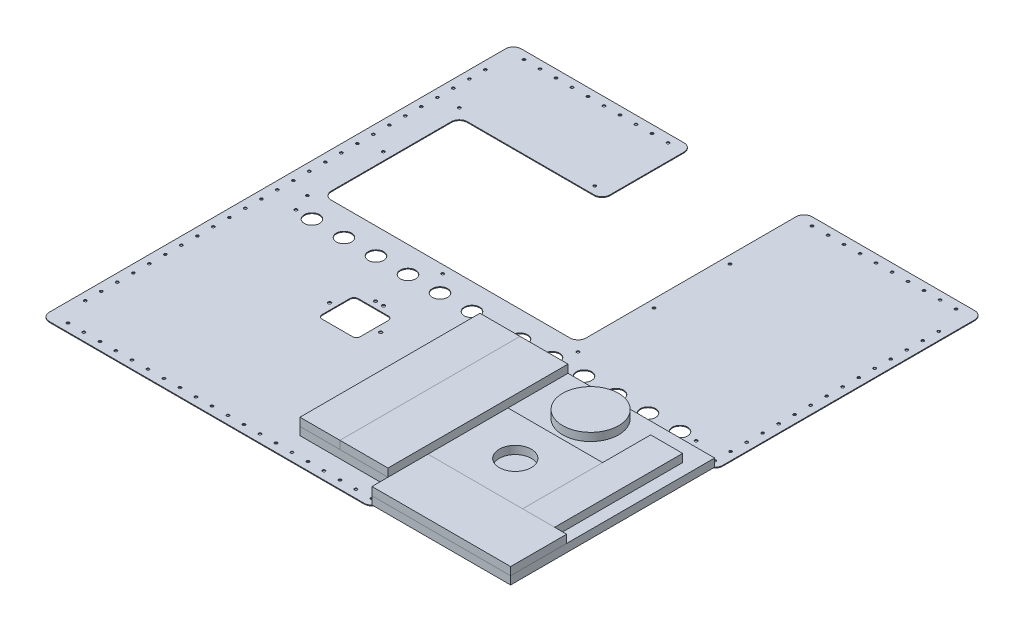
from build123d import *

# Parameters (mm, degrees)
SKETCH1_W                      = 586.53
SKETCH1_H                      = 590
BASE_FLANGE1_DEPTH             = 1
SKETCH6_W                      = 173.27
SKETCH6_H                      = 255
SKETCH6_W_2                    = 318.27
SKETCH6_H_2                    = 170
CUT_EXTRUDE1_DEPTH             = 10
SKETCH9_W                      = 140
SKETCH9_H                      = 112.51
CUT_EXTRUDE2_DEPTH             = 10
FILLET1_R                      = 10
M3_CLEARANCE_HOLE1_AT_2_COUNT  = 2
M3_CLEARANCE_HOLE1_AT_2_PITCH  = 169.135
M3_CLEARANCE_HOLE1_AT_3_COUNT  = 2
M3_CLEARANCE_HOLE1_AT_3_PITCH  = 338.27
M3_CLEARANCE_HOLE1_AT_4_COUNT  = 2
M3_CLEARANCE_HOLE1_AT_4_PITCH  = 351.356788607
M3_CLEARANCE_HOLE1_AT_5_COUNT  = 2
M3_CLEARANCE_HOLE1_AT_5_PITCH  = 387.977567522
M3_CLEARANCE_HOLE1_AT_6_COUNT  = 2
M3_CLEARANCE_HOLE1_AT_6_PITCH  = 254.375014939
M3_CLEARANCE_HOLE1_AT_7_COUNT  = 2
M3_CLEARANCE_HOLE1_AT_7_PITCH  = 190
M3_CLEARANCE_HOLE1_AT_8_COUNT  = 2
M3_CLEARANCE_HOLE1_AT_8_PITCH  = 95
M3_CLEARANCE_HOLE2_AT_2_COUNT  = 2
M3_CLEARANCE_HOLE2_AT_2_PITCH  = 20
M3_CLEARANCE_HOLE2_AT_3_COUNT  = 2
M3_CLEARANCE_HOLE2_AT_3_PITCH  = 40
M3_CLEARANCE_HOLE2_AT_4_COUNT  = 2
M3_CLEARANCE_HOLE2_AT_4_PITCH  = 60
M3_CLEARANCE_HOLE2_AT_5_COUNT  = 2
M3_CLEARANCE_HOLE2_AT_5_PITCH  = 80
M3_CLEARANCE_HOLE2_AT_6_COUNT  = 2
M3_CLEARANCE_HOLE2_AT_6_PITCH  = 100
M3_CLEARANCE_HOLE2_AT_7_COUNT  = 2
M3_CLEARANCE_HOLE2_AT_7_PITCH  = 120
M3_CLEARANCE_HOLE2_AT_8_COUNT  = 2
M3_CLEARANCE_HOLE2_AT_8_PITCH  = 140
M3_CLEARANCE_HOLE2_AT_9_COUNT  = 2
M3_CLEARANCE_HOLE2_AT_9_PITCH  = 160
M3_CLEARANCE_HOLE2_AT_10_COUNT = 2
M3_CLEARANCE_HOLE2_AT_10_PITCH = 180
M3_CLEARANCE_HOLE2_AT_11_COUNT = 2
M3_CLEARANCE_HOLE2_AT_11_PITCH = 200
M3_CLEARANCE_HOLE2_AT_12_COUNT = 2
M3_CLEARANCE_HOLE2_AT_12_PITCH = 220
M3_CLEARANCE_HOLE2_AT_13_COUNT = 2
M3_CLEARANCE_HOLE2_AT_13_PITCH = 240
M3_CLEARANCE_HOLE2_AT_14_COUNT = 2
M3_CLEARANCE_HOLE2_AT_14_PITCH = 260
M3_CLEARANCE_HOLE2_AT_15_COUNT = 2
M3_CLEARANCE_HOLE2_AT_15_PITCH = 280
M3_CLEARANCE_HOLE2_AT_16_COUNT = 2
M3_CLEARANCE_HOLE2_AT_16_PITCH = 300
M3_CLEARANCE_HOLE2_AT_17_COUNT = 2
M3_CLEARANCE_HOLE2_AT_17_PITCH = 320
M3_CLEARANCE_HOLE2_AT_18_COUNT = 2
M3_CLEARANCE_HOLE2_AT_18_PITCH = 340
M3_CLEARANCE_HOLE2_AT_19_COUNT = 2
M3_CLEARANCE_HOLE2_AT_19_PITCH = 360
M3_CLEARANCE_HOLE2_AT_20_COUNT = 2
M3_CLEARANCE_HOLE2_AT_20_PITCH = 380
M3_CLEARANCE_HOLE2_AT_21_COUNT = 2
M3_CLEARANCE_HOLE2_AT_21_PITCH = 37.427631504
M3_CLEARANCE_HOLE2_AT_22_COUNT = 2
M3_CLEARANCE_HOLE2_AT_22_PITCH = 56.575857042
M3_CLEARANCE_HOLE2_AT_23_COUNT = 2
M3_CLEARANCE_HOLE2_AT_23_PITCH = 76.163164325
M3_CLEARANCE_HOLE2_AT_24_COUNT = 2
M3_CLEARANCE_HOLE2_AT_24_PITCH = 95.920944532
M3_CLEARANCE_HOLE2_AT_25_COUNT = 2
M3_CLEARANCE_HOLE2_AT_25_PITCH = 115.76194366
M3_CLEARANCE_HOLE2_AT_26_COUNT = 2
M3_CLEARANCE_HOLE2_AT_26_PITCH = 135.649650202
M3_CLEARANCE_HOLE2_AT_27_COUNT = 2
M3_CLEARANCE_HOLE2_AT_27_PITCH = 155.566151845
M3_CLEARANCE_HOLE2_AT_28_COUNT = 2
M3_CLEARANCE_HOLE2_AT_28_PITCH = 175.501645576
M3_CLEARANCE_HOLE2_AT_29_COUNT = 2
M3_CLEARANCE_HOLE2_AT_29_PITCH = 195.45032003
M3_CLEARANCE_HOLE2_AT_30_COUNT = 2
M3_CLEARANCE_HOLE2_AT_30_PITCH = 215.408513295
M3_CLEARANCE_HOLE2_AT_31_COUNT = 2
M3_CLEARANCE_HOLE2_AT_31_PITCH = 235.37380398
M3_CLEARANCE_HOLE2_AT_32_COUNT = 2
M3_CLEARANCE_HOLE2_AT_32_PITCH = 255.344527257
M3_CLEARANCE_HOLE2_AT_33_COUNT = 2
M3_CLEARANCE_HOLE2_AT_33_PITCH = 275.319500944
M3_CLEARANCE_HOLE2_AT_34_COUNT = 2
M3_CLEARANCE_HOLE2_AT_34_PITCH = 295.297862505
M3_CLEARANCE_HOLE2_AT_35_COUNT = 2
M3_CLEARANCE_HOLE2_AT_35_PITCH = 315.2789679
M3_CLEARANCE_HOLE2_AT_36_COUNT = 2
M3_CLEARANCE_HOLE2_AT_36_PITCH = 335.262326544
M3_CLEARANCE_HOLE2_AT_37_COUNT = 2
M3_CLEARANCE_HOLE2_AT_37_PITCH = 355.24755819
M3_CLEARANCE_HOLE2_AT_38_COUNT = 2
M3_CLEARANCE_HOLE2_AT_38_PITCH = 375.234363565
M3_CLEARANCE_HOLE2_AT_39_COUNT = 2
M3_CLEARANCE_HOLE2_AT_39_PITCH = 395.222503914
M3_CLEARANCE_HOLE2_AT_40_COUNT = 2
M3_CLEARANCE_HOLE2_AT_40_PITCH = 415.211786442
M3_CLEARANCE_HOLE2_AT_41_COUNT = 2
M3_CLEARANCE_HOLE2_AT_41_PITCH = 435.202053764
M3_CLEARANCE_HOLE2_AT_42_COUNT = 2
M3_CLEARANCE_HOLE2_AT_42_PITCH = 455.193176135
M3_CLEARANCE_HOLE2_AT_43_COUNT = 2
M3_CLEARANCE_HOLE2_AT_43_PITCH = 475.18504564
M3_CLEARANCE_HOLE2_AT_44_COUNT = 2
M3_CLEARANCE_HOLE2_AT_44_PITCH = 495.177571786
M3_CLEARANCE_HOLE2_AT_45_COUNT = 2
M3_CLEARANCE_HOLE2_AT_45_PITCH = 515.170678125
M3_CLEARANCE_HOLE2_AT_46_COUNT = 2
M3_CLEARANCE_HOLE2_AT_46_PITCH = 535.164299631
M3_CLEARANCE_HOLE2_AT_47_COUNT = 2
M3_CLEARANCE_HOLE2_AT_47_PITCH = 769.631530604
M3_CLEARANCE_HOLE2_AT_48_COUNT = 2
M3_CLEARANCE_HOLE2_AT_48_PITCH = 755.865525672
M3_CLEARANCE_HOLE2_AT_49_COUNT = 2
M3_CLEARANCE_HOLE2_AT_49_PITCH = 742.383117332
M3_CLEARANCE_HOLE2_AT_50_COUNT = 2
M3_CLEARANCE_HOLE2_AT_50_PITCH = 729.200036273
M3_CLEARANCE_HOLE2_AT_51_COUNT = 2
M3_CLEARANCE_HOLE2_AT_51_PITCH = 716.332808756
M3_CLEARANCE_HOLE2_AT_52_COUNT = 2
M3_CLEARANCE_HOLE2_AT_52_PITCH = 703.798758808
M3_CLEARANCE_HOLE2_AT_53_COUNT = 2
M3_CLEARANCE_HOLE2_AT_53_PITCH = 691.616001044
M3_CLEARANCE_HOLE2_AT_54_COUNT = 2
M3_CLEARANCE_HOLE2_AT_54_PITCH = 679.803422248
M3_CLEARANCE_HOLE2_AT_55_COUNT = 2
M3_CLEARANCE_HOLE2_AT_55_PITCH = 668.380649705
M3_CLEARANCE_HOLE2_AT_56_COUNT = 2
M3_CLEARANCE_HOLE2_AT_56_PITCH = 657.368004165
M3_CLEARANCE_HOLE2_AT_57_COUNT = 2
M3_CLEARANCE_HOLE2_AT_57_PITCH = 646.786435309
M3_CLEARANCE_HOLE2_AT_58_COUNT = 2
M3_CLEARANCE_HOLE2_AT_58_PITCH = 636.657437638
M3_CLEARANCE_HOLE2_AT_59_COUNT = 2
M3_CLEARANCE_HOLE2_AT_59_PITCH = 627.002944889
M3_CLEARANCE_HOLE2_AT_60_COUNT = 2
M3_CLEARANCE_HOLE2_AT_60_PITCH = 617.845201406
M3_CLEARANCE_HOLE2_AT_61_COUNT = 2
M3_CLEARANCE_HOLE2_AT_61_PITCH = 609.20660937
M3_CLEARANCE_HOLE2_AT_62_COUNT = 2
M3_CLEARANCE_HOLE2_AT_62_PITCH = 570
M3_CLEARANCE_HOLE2_AT_63_COUNT = 2
M3_CLEARANCE_HOLE2_AT_63_PITCH = 570.350769264
M3_CLEARANCE_HOLE2_AT_64_COUNT = 2
M3_CLEARANCE_HOLE2_AT_64_PITCH = 571.401785086
M3_CLEARANCE_HOLE2_AT_65_COUNT = 2
M3_CLEARANCE_HOLE2_AT_65_PITCH = 573.149195236
M3_CLEARANCE_HOLE2_AT_66_COUNT = 2
M3_CLEARANCE_HOLE2_AT_66_PITCH = 575.586657246
M3_CLEARANCE_HOLE2_AT_67_COUNT = 2
M3_CLEARANCE_HOLE2_AT_67_PITCH = 578.705451849
M3_CLEARANCE_HOLE2_AT_68_COUNT = 2
M3_CLEARANCE_HOLE2_AT_68_PITCH = 582.494635168
M3_CLEARANCE_HOLE2_AT_69_COUNT = 2
M3_CLEARANCE_HOLE2_AT_69_PITCH = 586.941223633
M3_CLEARANCE_HOLE2_AT_70_COUNT = 2
M3_CLEARANCE_HOLE2_AT_70_PITCH = 592.030404625
M3_CLEARANCE_HOLE2_AT_71_COUNT = 2
M3_CLEARANCE_HOLE2_AT_71_PITCH = 597.745765355
M3_CLEARANCE_HOLE2_AT_72_COUNT = 2
M3_CLEARANCE_HOLE2_AT_72_PITCH = 785.182017178
M3_CLEARANCE_HOLE2_AT_73_COUNT = 2
M3_CLEARANCE_HOLE2_AT_73_PITCH = 771.563607294
M3_CLEARANCE_HOLE2_AT_74_COUNT = 2
M3_CLEARANCE_HOLE2_AT_74_PITCH = 758.228197906
M3_CLEARANCE_HOLE2_AT_75_COUNT = 2
M3_CLEARANCE_HOLE2_AT_75_PITCH = 745.190982299
M3_CLEARANCE_HOLE2_AT_76_COUNT = 2
M3_CLEARANCE_HOLE2_AT_76_PITCH = 732.467883323
M3_CLEARANCE_HOLE2_AT_77_COUNT = 2
M3_CLEARANCE_HOLE2_AT_77_PITCH = 720.075551661
M3_CLEARANCE_HOLE2_AT_78_COUNT = 2
M3_CLEARANCE_HOLE2_AT_78_PITCH = 708.031355309
M3_CLEARANCE_HOLE2_AT_79_COUNT = 2
M3_CLEARANCE_HOLE2_AT_79_PITCH = 696.353358648
M3_CLEARANCE_HOLE2_AT_80_COUNT = 2
M3_CLEARANCE_HOLE2_AT_80_PITCH = 685.060289391
M3_CLEARANCE_HOLE2_AT_81_COUNT = 2
M3_CLEARANCE_HOLE2_AT_81_PITCH = 674.17149161
SKETCH14_R                     = 9.55
CUT_EXTRUDE3_DEPTH             = 10
SKETCH15_R                     = 1.95
CUT_EXTRUDE5_DEPTH             = 416.969181821
SKETCH16_R                     = 1.75
CUT_EXTRUDE6_DEPTH             = 416.969181821
BOSS_EXTRUDE5_START            = 3
BOSS_EXTRUDE5_DEPTH            = 10
SKETCH18_W                     = 50
SKETCH18_H                     = 225
INSTRUMENTATION_DEPTH          = 10
SKETCH18_4_W                   = 59.995
SKETCH18_4_H                   = 225
LIFE_DETECTION_DEPTH           = 10
SKETCH18_5_R                   = 35
PROCESSING_CENTRIFUGE_DEPTH    = 10
PROCESSING_FILTRATION_DEPTH    = 10
COLLECTION_DEPTH               = 10
SKETCH18_9_W                   = 118.27
SKETCH18_9_H                   = 100
SKETCH18_9_R                   = 20
ELECTRICAL_SYSTEMS_DEPTH       = 10


# Sheet-metal steps are written as plain solids
with BuildPart() as part:
    # Sketch1 → Base-Flange1 (new body)
    with BuildSketch(Plane(origin=(0, 0, 0), x_dir=(1, 0, 0), z_dir=(0, 1, 0))):
        Rectangle(SKETCH1_W, SKETCH1_H)
    extrude(amount=-BASE_FLANGE1_DEPTH)

    # Sketch6 → Cut-Extrude1 (cut)
    with BuildSketch(Plane(origin=(0, 0, 0), x_dir=(1, 0, 0), z_dir=(0, 1, 0))):
        with Locations((206.63, -167.5)):
            Rectangle(SKETCH6_W, SKETCH6_H)
        with Locations((-89.13, 97.5)):
            Rectangle(SKETCH6_W_2, SKETCH6_H_2)
    extrude(amount=-CUT_EXTRUDE1_DEPTH, mode=Mode.SUBTRACT)

    # Sketch9 → Cut-Extrude2 (cut)
    with BuildSketch(Plane(origin=(0, 0, 0), x_dir=(1, 0, 0), z_dir=(0, 1, 0))):
        with Locations((0, 238.745)):
            Rectangle(SKETCH9_W, SKETCH9_H)
    extrude(amount=-CUT_EXTRUDE2_DEPTH, mode=Mode.SUBTRACT)

    # Fillet1
    fillet1_edges = [part.edges().sort_by_distance(p)[0] for p in [
        (293.265, -0.5, 40),
        (119.995, -0.5, 295),
        (119.995, -0.5, 40),
        (70.005, -0.5, -12.5),
        (-248.265, -0.5, -12.5),
        (-248.265, -0.5, -182.5),
        (-70, -0.5, -182.5),
        (-70, -0.5, -295),
        (70, -0.5, -295),
        (-293.265, -0.5, 295),
        (-293.265, -0.5, -295),
        (293.265, -0.5, -295),
    ]]
    fillet(fillet1_edges, radius=FILLET1_R)

    # Sketch11 → M3 Clearance Hole1 (revolve, cut)
    with BuildSketch(Plane(origin=(80.005, 0, -192.5), x_dir=(0, 0, 1), z_dir=(1, 0, 0))):
        Polygon((0, 0), (0, 1), (1.7, 1), (1.7, 0.025), (1.725, 0), align=None)
    m3_clearance_hole1 = revolve(axis=Axis((80.005, 6.35, -192.5), (0, -1, 0)), mode=Mode.SUBTRACT)

    # M3 Clearance Hole1 at 2: M3 Clearance Hole1 ×2
    with Locations(*[(-i * M3_CLEARANCE_HOLE1_AT_2_PITCH, 0, 0) for i in range(1, M3_CLEARANCE_HOLE1_AT_2_COUNT)]):
        add(m3_clearance_hole1, mode=Mode.SUBTRACT)

    # M3 Clearance Hole1 at 3: M3 Clearance Hole1 ×2
    with Locations(*[(-i * M3_CLEARANCE_HOLE1_AT_3_PITCH, 0, 0) for i in range(1, M3_CLEARANCE_HOLE1_AT_3_COUNT)]):
        add(m3_clearance_hole1, mode=Mode.SUBTRACT)

    # M3 Clearance Hole1 at 4: M3 Clearance Hole1 ×2
    with Locations(*[Vector(-0.9627535626717866, 0, 0.27038043117574634) * (i * M3_CLEARANCE_HOLE1_AT_4_PITCH) for i in range(1, M3_CLEARANCE_HOLE1_AT_4_COUNT)]):
        add(m3_clearance_hole1, mode=Mode.SUBTRACT)

    # M3 Clearance Hole1 at 5: M3 Clearance Hole1 ×2
    with Locations(*[Vector(-0.8718803052476541, 0, 0.48971903508160425) * (i * M3_CLEARANCE_HOLE1_AT_5_PITCH) for i in range(1, M3_CLEARANCE_HOLE1_AT_5_COUNT)]):
        add(m3_clearance_hole1, mode=Mode.SUBTRACT)

    # M3 Clearance Hole1 at 6: M3 Clearance Hole1 ×2
    with Locations(*[Vector(-0.6649041378566292, 0, 0.7469287030641766) * (i * M3_CLEARANCE_HOLE1_AT_6_PITCH) for i in range(1, M3_CLEARANCE_HOLE1_AT_6_COUNT)]):
        add(m3_clearance_hole1, mode=Mode.SUBTRACT)

    # M3 Clearance Hole1 at 7: M3 Clearance Hole1 ×2
    with Locations(*[(0, 0, i * M3_CLEARANCE_HOLE1_AT_7_PITCH) for i in range(1, M3_CLEARANCE_HOLE1_AT_7_COUNT)]):
        add(m3_clearance_hole1, mode=Mode.SUBTRACT)

    # M3 Clearance Hole1 at 8: M3 Clearance Hole1 ×2
    with Locations(*[(0, 0, i * M3_CLEARANCE_HOLE1_AT_8_PITCH) for i in range(1, M3_CLEARANCE_HOLE1_AT_8_COUNT)]):
        add(m3_clearance_hole1, mode=Mode.SUBTRACT)

    # Sketch13 → M3 Clearance Hole2 (revolve, cut)
    with BuildSketch(Plane(origin=(-270.005, 0, 285), x_dir=(0, 0, 1), z_dir=(1, 0, 0))):
        Polygon((0, 0), (0, 1), (1.7, 1), (1.7, 0.025), (1.725, 0), align=None)
    m3_clearance_hole2 = revolve(axis=Axis((-270.005, 6.35, 285), (0, -1, 0)), mode=Mode.SUBTRACT)

    # M3 Clearance Hole2 at 2: M3 Clearance Hole2 ×2
    with Locations(*[(i * M3_CLEARANCE_HOLE2_AT_2_PITCH, 0, 0) for i in range(1, M3_CLEARANCE_HOLE2_AT_2_COUNT)]):
        add(m3_clearance_hole2, mode=Mode.SUBTRACT)

    # M3 Clearance Hole2 at 3: M3 Clearance Hole2 ×2
    with Locations(*[(i * M3_CLEARANCE_HOLE2_AT_3_PITCH, 0, 0) for i in range(1, M3_CLEARANCE_HOLE2_AT_3_COUNT)]):
        add(m3_clearance_hole2, mode=Mode.SUBTRACT)

    # M3 Clearance Hole2 at 4: M3 Clearance Hole2 ×2
    with Locations(*[(i * M3_CLEARANCE_HOLE2_AT_4_PITCH, 0, 0) for i in range(1, M3_CLEARANCE_HOLE2_AT_4_COUNT)]):
        add(m3_clearance_hole2, mode=Mode.SUBTRACT)

    # M3 Clearance Hole2 at 5: M3 Clearance Hole2 ×2
    with Locations(*[(i * M3_CLEARANCE_HOLE2_AT_5_PITCH, 0, 0) for i in range(1, M3_CLEARANCE_HOLE2_AT_5_COUNT)]):
        add(m3_clearance_hole2, mode=Mode.SUBTRACT)

    # M3 Clearance Hole2 at 6: M3 Clearance Hole2 ×2
    with Locations(*[(i * M3_CLEARANCE_HOLE2_AT_6_PITCH, 0, 0) for i in range(1, M3_CLEARANCE_HOLE2_AT_6_COUNT)]):
        add(m3_clearance_hole2, mode=Mode.SUBTRACT)

    # M3 Clearance Hole2 at 7: M3 Clearance Hole2 ×2
    with Locations(*[(i * M3_CLEARANCE_HOLE2_AT_7_PITCH, 0, 0) for i in range(1, M3_CLEARANCE_HOLE2_AT_7_COUNT)]):
        add(m3_clearance_hole2, mode=Mode.SUBTRACT)

    # M3 Clearance Hole2 at 8: M3 Clearance Hole2 ×2
    with Locations(*[(i * M3_CLEARANCE_HOLE2_AT_8_PITCH, 0, 0) for i in range(1, M3_CLEARANCE_HOLE2_AT_8_COUNT)]):
        add(m3_clearance_hole2, mode=Mode.SUBTRACT)

    # M3 Clearance Hole2 at 9: M3 Clearance Hole2 ×2
    with Locations(*[(i * M3_CLEARANCE_HOLE2_AT_9_PITCH, 0, 0) for i in range(1, M3_CLEARANCE_HOLE2_AT_9_COUNT)]):
        add(m3_clearance_hole2, mode=Mode.SUBTRACT)

    # M3 Clearance Hole2 at 10: M3 Clearance Hole2 ×2
    with Locations(*[(i * M3_CLEARANCE_HOLE2_AT_10_PITCH, 0, 0) for i in range(1, M3_CLEARANCE_HOLE2_AT_10_COUNT)]):
        add(m3_clearance_hole2, mode=Mode.SUBTRACT)

    # M3 Clearance Hole2 at 11: M3 Clearance Hole2 ×2
    with Locations(*[(i * M3_CLEARANCE_HOLE2_AT_11_PITCH, 0, 0) for i in range(1, M3_CLEARANCE_HOLE2_AT_11_COUNT)]):
        add(m3_clearance_hole2, mode=Mode.SUBTRACT)

    # M3 Clearance Hole2 at 12: M3 Clearance Hole2 ×2
    with Locations(*[(i * M3_CLEARANCE_HOLE2_AT_12_PITCH, 0, 0) for i in range(1, M3_CLEARANCE_HOLE2_AT_12_COUNT)]):
        add(m3_clearance_hole2, mode=Mode.SUBTRACT)

    # M3 Clearance Hole2 at 13: M3 Clearance Hole2 ×2
    with Locations(*[(i * M3_CLEARANCE_HOLE2_AT_13_PITCH, 0, 0) for i in range(1, M3_CLEARANCE_HOLE2_AT_13_COUNT)]):
        add(m3_clearance_hole2, mode=Mode.SUBTRACT)

    # M3 Clearance Hole2 at 14: M3 Clearance Hole2 ×2
    with Locations(*[(i * M3_CLEARANCE_HOLE2_AT_14_PITCH, 0, 0) for i in range(1, M3_CLEARANCE_HOLE2_AT_14_COUNT)]):
        add(m3_clearance_hole2, mode=Mode.SUBTRACT)

    # M3 Clearance Hole2 at 15: M3 Clearance Hole2 ×2
    with Locations(*[(i * M3_CLEARANCE_HOLE2_AT_15_PITCH, 0, 0) for i in range(1, M3_CLEARANCE_HOLE2_AT_15_COUNT)]):
        add(m3_clearance_hole2, mode=Mode.SUBTRACT)

    # M3 Clearance Hole2 at 16: M3 Clearance Hole2 ×2
    with Locations(*[(i * M3_CLEARANCE_HOLE2_AT_16_PITCH, 0, 0) for i in range(1, M3_CLEARANCE_HOLE2_AT_16_COUNT)]):
        add(m3_clearance_hole2, mode=Mode.SUBTRACT)

    # M3 Clearance Hole2 at 17: M3 Clearance Hole2 ×2
    with Locations(*[(i * M3_CLEARANCE_HOLE2_AT_17_PITCH, 0, 0) for i in range(1, M3_CLEARANCE_HOLE2_AT_17_COUNT)]):
        add(m3_clearance_hole2, mode=Mode.SUBTRACT)

    # M3 Clearance Hole2 at 18: M3 Clearance Hole2 ×2
    with Locations(*[(i * M3_CLEARANCE_HOLE2_AT_18_PITCH, 0, 0) for i in range(1, M3_CLEARANCE_HOLE2_AT_18_COUNT)]):
        add(m3_clearance_hole2, mode=Mode.SUBTRACT)

    # M3 Clearance Hole2 at 19: M3 Clearance Hole2 ×2
    with Locations(*[(i * M3_CLEARANCE_HOLE2_AT_19_PITCH, 0, 0) for i in range(1, M3_CLEARANCE_HOLE2_AT_19_COUNT)]):
        add(m3_clearance_hole2, mode=Mode.SUBTRACT)

    # M3 Clearance Hole2 at 20: M3 Clearance Hole2 ×2
    with Locations(*[(i * M3_CLEARANCE_HOLE2_AT_20_PITCH, 0, 0) for i in range(1, M3_CLEARANCE_HOLE2_AT_20_COUNT)]):
        add(m3_clearance_hole2, mode=Mode.SUBTRACT)

    # M3 Clearance Hole2 at 21: M3 Clearance Hole2 ×2
    with Locations(*[Vector(-0.3542837061057186, 0, -0.9351379874585337) * (i * M3_CLEARANCE_HOLE2_AT_21_PITCH) for i in range(1, M3_CLEARANCE_HOLE2_AT_21_COUNT)]):
        add(m3_clearance_hole2, mode=Mode.SUBTRACT)

    # M3 Clearance Hole2 at 22: M3 Clearance Hole2 ×2
    with Locations(*[Vector(-0.23437559222889967, 0, -0.9721461216130797) * (i * M3_CLEARANCE_HOLE2_AT_22_PITCH) for i in range(1, M3_CLEARANCE_HOLE2_AT_22_COUNT)]):
        add(m3_clearance_hole2, mode=Mode.SUBTRACT)

    # M3 Clearance Hole2 at 23: M3 Clearance Hole2 ×2
    with Locations(*[Vector(-0.1740999092870426, 0, -0.9847279937049843) * (i * M3_CLEARANCE_HOLE2_AT_23_PITCH) for i in range(1, M3_CLEARANCE_HOLE2_AT_23_COUNT)]):
        add(m3_clearance_hole2, mode=Mode.SUBTRACT)

    # M3 Clearance Hole2 at 24: M3 Clearance Hole2 ×2
    with Locations(*[Vector(-0.138238838917109, 0, -0.9903989213518205) * (i * M3_CLEARANCE_HOLE2_AT_24_PITCH) for i in range(1, M3_CLEARANCE_HOLE2_AT_24_COUNT)]):
        add(m3_clearance_hole2, mode=Mode.SUBTRACT)

    # M3 Clearance Hole2 at 25: M3 Clearance Hole2 ×2
    with Locations(*[Vector(-0.11454541605587176, 0, -0.9934180125509037) * (i * M3_CLEARANCE_HOLE2_AT_25_PITCH) for i in range(1, M3_CLEARANCE_HOLE2_AT_25_COUNT)]):
        add(m3_clearance_hole2, mode=Mode.SUBTRACT)

    # M3 Clearance Hole2 at 26: M3 Clearance Hole2 ×2
    with Locations(*[Vector(-0.09775181860201942, 0, -0.9952108228712135) * (i * M3_CLEARANCE_HOLE2_AT_26_PITCH) for i in range(1, M3_CLEARANCE_HOLE2_AT_26_COUNT)]):
        add(m3_clearance_hole2, mode=Mode.SUBTRACT)

    # M3 Clearance Hole2 at 27: M3 Clearance Hole2 ×2
    with Locations(*[Vector(-0.08523705087964259, 0, -0.9963607003276179) * (i * M3_CLEARANCE_HOLE2_AT_27_PITCH) for i in range(1, M3_CLEARANCE_HOLE2_AT_27_COUNT)]):
        add(m3_clearance_hole2, mode=Mode.SUBTRACT)

    # M3 Clearance Hole2 at 28: M3 Clearance Hole2 ×2
    with Locations(*[Vector(-0.07555484711528443, 0, -0.9971416474490402) * (i * M3_CLEARANCE_HOLE2_AT_28_PITCH) for i in range(1, M3_CLEARANCE_HOLE2_AT_28_COUNT)]):
        add(m3_clearance_hole2, mode=Mode.SUBTRACT)

    # M3 Clearance Hole2 at 29: M3 Clearance Hole2 ×2
    with Locations(*[Vector(-0.06784332713262199, 0, -0.997695987244399) * (i * M3_CLEARANCE_HOLE2_AT_29_PITCH) for i in range(1, M3_CLEARANCE_HOLE2_AT_29_COUNT)]):
        add(m3_clearance_hole2, mode=Mode.SUBTRACT)

    # M3 Clearance Hole2 at 30: M3 Clearance Hole2 ×2
    with Locations(*[Vector(-0.06155745563238609, 0, -0.9981035415507085) * (i * M3_CLEARANCE_HOLE2_AT_30_PITCH) for i in range(1, M3_CLEARANCE_HOLE2_AT_30_COUNT)]):
        add(m3_clearance_hole2, mode=Mode.SUBTRACT)

    # M3 Clearance Hole2 at 31: M3 Clearance Hole2 ×2
    with Locations(*[Vector(-0.056335920887480066, 0, -0.9984118709319113) * (i * M3_CLEARANCE_HOLE2_AT_31_PITCH) for i in range(1, M3_CLEARANCE_HOLE2_AT_31_COUNT)]):
        add(m3_clearance_hole2, mode=Mode.SUBTRACT)

    # M3 Clearance Hole2 at 32: M3 Clearance Hole2 ×2
    with Locations(*[Vector(-0.051929838256000956, 0, -0.9986507356922668) * (i * M3_CLEARANCE_HOLE2_AT_32_PITCH) for i in range(1, M3_CLEARANCE_HOLE2_AT_32_COUNT)]):
        add(m3_clearance_hole2, mode=Mode.SUBTRACT)

    # M3 Clearance Hole2 at 33: M3 Clearance Hole2 ×2
    with Locations(*[Vector(-0.04816222590314291, 0, -0.9988395266488279) * (i * M3_CLEARANCE_HOLE2_AT_33_PITCH) for i in range(1, M3_CLEARANCE_HOLE2_AT_33_COUNT)]):
        add(m3_clearance_hole2, mode=Mode.SUBTRACT)

    # M3 Clearance Hole2 at 34: M3 Clearance Hole2 ×2
    with Locations(*[Vector(-0.04490381300940858, 0, -0.9989913150659601) * (i * M3_CLEARANCE_HOLE2_AT_34_PITCH) for i in range(1, M3_CLEARANCE_HOLE2_AT_34_COUNT)]):
        add(m3_clearance_hole2, mode=Mode.SUBTRACT)

    # M3 Clearance Hole2 at 35: M3 Clearance Hole2 ×2
    with Locations(*[Vector(-0.04205799101769677, 0, -0.9991151712348059) * (i * M3_CLEARANCE_HOLE2_AT_35_PITCH) for i in range(1, M3_CLEARANCE_HOLE2_AT_35_COUNT)]):
        add(m3_clearance_hole2, mode=Mode.SUBTRACT)

    # M3 Clearance Hole2 at 36: M3 Clearance Hole2 ×2
    with Locations(*[Vector(-0.039551118482866195, 0, -0.9992175483981225) * (i * M3_CLEARANCE_HOLE2_AT_36_PITCH) for i in range(1, M3_CLEARANCE_HOLE2_AT_36_COUNT)]):
        add(m3_clearance_hole2, mode=Mode.SUBTRACT)

    # M3 Clearance Hole2 at 37: M3 Clearance Hole2 ×2
    with Locations(*[Vector(-0.03732608344321662, 0, -0.9993031389397264) * (i * M3_CLEARANCE_HOLE2_AT_37_PITCH) for i in range(1, M3_CLEARANCE_HOLE2_AT_37_COUNT)]):
        add(m3_clearance_hole2, mode=Mode.SUBTRACT)

    # M3 Clearance Hole2 at 38: M3 Clearance Hole2 ×2
    with Locations(*[Vector(-0.03533791488077733, 0, -0.9993754208363737) * (i * M3_CLEARANCE_HOLE2_AT_38_PITCH) for i in range(1, M3_CLEARANCE_HOLE2_AT_38_COUNT)]):
        add(m3_clearance_hole2, mode=Mode.SUBTRACT)

    # M3 Clearance Hole2 at 39: M3 Clearance Hole2 ×2
    with Locations(*[Vector(-0.03355072109681487, 0, -0.9994370160814956) * (i * M3_CLEARANCE_HOLE2_AT_39_PITCH) for i in range(1, M3_CLEARANCE_HOLE2_AT_39_COUNT)]):
        add(m3_clearance_hole2, mode=Mode.SUBTRACT)

    # M3 Clearance Hole2 at 40: M3 Clearance Hole2 ×2
    with Locations(*[Vector(-0.03193550961941994, 0, -0.9994899315277508) * (i * M3_CLEARANCE_HOLE2_AT_40_PITCH) for i in range(1, M3_CLEARANCE_HOLE2_AT_40_COUNT)]):
        add(m3_clearance_hole2, mode=Mode.SUBTRACT)

    # M3 Clearance Hole2 at 41: M3 Clearance Hole2 ×2
    with Locations(*[Vector(-0.03046860621481826, 0, -0.9995357242416733) * (i * M3_CLEARANCE_HOLE2_AT_41_PITCH) for i in range(1, M3_CLEARANCE_HOLE2_AT_41_COUNT)]):
        add(m3_clearance_hole2, mode=Mode.SUBTRACT)

    # M3 Clearance Hole2 at 42: M3 Clearance Hole2 ×2
    with Locations(*[Vector(-0.02913048941679347, 0, -0.9995756172428067) * (i * M3_CLEARANCE_HOLE2_AT_42_PITCH) for i in range(1, M3_CLEARANCE_HOLE2_AT_42_COUNT)]):
        add(m3_clearance_hole2, mode=Mode.SUBTRACT)

    # M3 Clearance Hole2 at 43: M3 Clearance Hole2 ×2
    with Locations(*[Vector(-0.027904918561018805, 0, -0.9996105819368375) * (i * M3_CLEARANCE_HOLE2_AT_43_PITCH) for i in range(1, M3_CLEARANCE_HOLE2_AT_43_COUNT)]):
        add(m3_clearance_hole2, mode=Mode.SUBTRACT)

    # M3 Clearance Hole2 at 44: M3 Clearance Hole2 ×2
    with Locations(*[Vector(-0.026778272594560903, 0, -0.9996413977606426) * (i * M3_CLEARANCE_HOLE2_AT_44_PITCH) for i in range(1, M3_CLEARANCE_HOLE2_AT_44_COUNT)]):
        add(m3_clearance_hole2, mode=Mode.SUBTRACT)

    # M3 Clearance Hole2 at 45: M3 Clearance Hole2 ×2
    with Locations(*[Vector(-0.02573904254072972, 0, -0.9996686959633609) * (i * M3_CLEARANCE_HOLE2_AT_45_PITCH) for i in range(1, M3_CLEARANCE_HOLE2_AT_45_COUNT)]):
        add(m3_clearance_hole2, mode=Mode.SUBTRACT)

    # M3 Clearance Hole2 at 46: M3 Clearance Hole2 ×2
    with Locations(*[Vector(-0.024777437525511124, 0, -0.9996929921679303) * (i * M3_CLEARANCE_HOLE2_AT_46_PITCH) for i in range(1, M3_CLEARANCE_HOLE2_AT_46_COUNT)]):
        add(m3_clearance_hole2, mode=Mode.SUBTRACT)

    # M3 Clearance Hole2 at 47: M3 Clearance Hole2 ×2
    with Locations(*[Vector(0.7188764727008147, 0, -0.6951378402858205) * (i * M3_CLEARANCE_HOLE2_AT_47_PITCH) for i in range(1, M3_CLEARANCE_HOLE2_AT_47_COUNT)]):
        add(m3_clearance_hole2, mode=Mode.SUBTRACT)

    # M3 Clearance Hole2 at 48: M3 Clearance Hole2 ×2
    with Locations(*[Vector(0.7319688240945119, 0, -0.6813381249817874) * (i * M3_CLEARANCE_HOLE2_AT_48_PITCH) for i in range(1, M3_CLEARANCE_HOLE2_AT_48_COUNT)]):
        add(m3_clearance_hole2, mode=Mode.SUBTRACT)

    # M3 Clearance Hole2 at 49: M3 Clearance Hole2 ×2
    with Locations(*[Vector(0.7452620986158033, 0, -0.6667716283456944) * (i * M3_CLEARANCE_HOLE2_AT_49_PITCH) for i in range(1, M3_CLEARANCE_HOLE2_AT_49_COUNT)]):
        add(m3_clearance_hole2, mode=Mode.SUBTRACT)

    # M3 Clearance Hole2 at 50: M3 Clearance Hole2 ×2
    with Locations(*[Vector(0.7587355629164406, 0, -0.6513987607954685) * (i * M3_CLEARANCE_HOLE2_AT_50_PITCH) for i in range(1, M3_CLEARANCE_HOLE2_AT_50_COUNT)]):
        add(m3_clearance_hole2, mode=Mode.SUBTRACT)

    # M3 Clearance Hole2 at 51: M3 Clearance Hole2 ×2
    with Locations(*[Vector(0.7723644557911035, 0, -0.6351796182423618) * (i * M3_CLEARANCE_HOLE2_AT_51_PITCH) for i in range(1, M3_CLEARANCE_HOLE2_AT_51_COUNT)]):
        add(m3_clearance_hole2, mode=Mode.SUBTRACT)

    # M3 Clearance Hole2 at 52: M3 Clearance Hole2 ×2
    with Locations(*[Vector(0.7861196017692288, 0, -0.6180744062927934) * (i * M3_CLEARANCE_HOLE2_AT_52_PITCH) for i in range(1, M3_CLEARANCE_HOLE2_AT_52_COUNT)]):
        add(m3_clearance_hole2, mode=Mode.SUBTRACT)

    # M3 Clearance Hole2 at 53: M3 Clearance Hole2 ×2
    with Locations(*[Vector(0.7999670325222225, 0, -0.600043954121354) * (i * M3_CLEARANCE_HOLE2_AT_53_PITCH) for i in range(1, M3_CLEARANCE_HOLE2_AT_53_COUNT)]):
        add(m3_clearance_hole2, mode=Mode.SUBTRACT)

    # M3 Clearance Hole2 at 54: M3 Clearance Hole2 ×2
    with Locations(*[Vector(0.8138676298075721, 0, -0.5810503258336619) * (i * M3_CLEARANCE_HOLE2_AT_54_PITCH) for i in range(1, M3_CLEARANCE_HOLE2_AT_54_COUNT)]):
        add(m3_clearance_hole2, mode=Mode.SUBTRACT)

    # M3 Clearance Hole2 at 55: M3 Clearance Hole2 ×2
    with Locations(*[Vector(0.8277768068902698, 0, -0.5610575353513659) * (i * M3_CLEARANCE_HOLE2_AT_55_PITCH) for i in range(1, M3_CLEARANCE_HOLE2_AT_55_COUNT)]):
        add(m3_clearance_hole2, mode=Mode.SUBTRACT)

    # M3 Clearance Hole2 at 56: M3 Clearance Hole2 ×2
    with Locations(*[Vector(0.8416442487228958, 0, -0.5400323680962766) * (i * M3_CLEARANCE_HOLE2_AT_56_PITCH) for i in range(1, M3_CLEARANCE_HOLE2_AT_56_COUNT)]):
        add(m3_clearance_hole2, mode=Mode.SUBTRACT)

    # M3 Clearance Hole2 at 57: M3 Clearance Hole2 ×2
    with Locations(*[Vector(0.8554137344199167, 0, -0.5179453088558408) * (i * M3_CLEARANCE_HOLE2_AT_57_PITCH) for i in range(1, M3_CLEARANCE_HOLE2_AT_57_COUNT)]):
        add(m3_clearance_hole2, mode=Mode.SUBTRACT)

    # M3 Clearance Hole2 at 58: M3 Clearance Hole2 ×2
    with Locations(*[Vector(0.8690230684376916, 0, -0.4947715700433274) * (i * M3_CLEARANCE_HOLE2_AT_58_PITCH) for i in range(1, M3_CLEARANCE_HOLE2_AT_58_COUNT)]):
        add(m3_clearance_hole2, mode=Mode.SUBTRACT)

    # M3 Clearance Hole2 at 59: M3 Clearance Hole2 ×2
    with Locations(*[Vector(0.8824041489910074, 0, -0.4704922080581741) * (i * M3_CLEARANCE_HOLE2_AT_59_PITCH) for i in range(1, M3_CLEARANCE_HOLE2_AT_59_COUNT)]):
        add(m3_clearance_hole2, mode=Mode.SUBTRACT)

    # M3 Clearance Hole2 at 60: M3 Clearance Hole2 ×2
    with Locations(*[Vector(0.8954832031409422, 0, -0.44509530765043814) * (i * M3_CLEARANCE_HOLE2_AT_60_PITCH) for i in range(1, M3_CLEARANCE_HOLE2_AT_60_COUNT)]):
        add(m3_clearance_hole2, mode=Mode.SUBTRACT)

    # M3 Clearance Hole2 at 61: M3 Clearance Hole2 ×2
    with Locations(*[Vector(0.9081812171608301, 0, -0.41857720529942055) * (i * M3_CLEARANCE_HOLE2_AT_61_PITCH) for i in range(1, M3_CLEARANCE_HOLE2_AT_61_COUNT)]):
        add(m3_clearance_hole2, mode=Mode.SUBTRACT)

    # M3 Clearance Hole2 at 62: M3 Clearance Hole2 ×2
    with Locations(*[(0, 0, -i * M3_CLEARANCE_HOLE2_AT_62_PITCH) for i in range(1, M3_CLEARANCE_HOLE2_AT_62_COUNT)]):
        add(m3_clearance_hole2, mode=Mode.SUBTRACT)

    # M3 Clearance Hole2 at 63: M3 Clearance Hole2 ×2
    with Locations(*[Vector(0.0350661401330445, 0, -0.9993849937917668) * (i * M3_CLEARANCE_HOLE2_AT_63_PITCH) for i in range(1, M3_CLEARANCE_HOLE2_AT_63_COUNT)]):
        add(m3_clearance_hole2, mode=Mode.SUBTRACT)

    # M3 Clearance Hole2 at 64: M3 Clearance Hole2 ×2
    with Locations(*[Vector(0.07000328148073091, 0, -0.9975467611004155) * (i * M3_CLEARANCE_HOLE2_AT_64_PITCH) for i in range(1, M3_CLEARANCE_HOLE2_AT_64_COUNT)]):
        add(m3_clearance_hole2, mode=Mode.SUBTRACT)

    # M3 Clearance Hole2 at 65: M3 Clearance Hole2 ×2
    with Locations(*[Vector(0.10468478451804275, 0, -0.9945054529214061) * (i * M3_CLEARANCE_HOLE2_AT_65_PITCH) for i in range(1, M3_CLEARANCE_HOLE2_AT_65_COUNT)]):
        add(m3_clearance_hole2, mode=Mode.SUBTRACT)

    # M3 Clearance Hole2 at 66: M3 Clearance Hole2 ×2
    with Locations(*[Vector(0.13898862837218873, 0, -0.9902939771518444) * (i * M3_CLEARANCE_HOLE2_AT_66_PITCH) for i in range(1, M3_CLEARANCE_HOLE2_AT_66_COUNT)]):
        add(m3_clearance_hole2, mode=Mode.SUBTRACT)

    # M3 Clearance Hole2 at 67: M3 Clearance Hole2 ×2
    with Locations(*[Vector(0.17279947800812526, 0, -0.984957024646314) * (i * M3_CLEARANCE_HOLE2_AT_67_PITCH) for i in range(1, M3_CLEARANCE_HOLE2_AT_67_COUNT)]):
        add(m3_clearance_hole2, mode=Mode.SUBTRACT)

    # M3 Clearance Hole2 at 68: M3 Clearance Hole2 ×2
    with Locations(*[Vector(0.2060104810498419, 0, -0.978549784986749) * (i * M3_CLEARANCE_HOLE2_AT_68_PITCH) for i in range(1, M3_CLEARANCE_HOLE2_AT_68_COUNT)]):
        add(m3_clearance_hole2, mode=Mode.SUBTRACT)

    # M3 Clearance Hole2 at 69: M3 Clearance Hole2 ×2
    with Locations(*[Vector(0.23852473529359494, 0, -0.9711364222667794) * (i * M3_CLEARANCE_HOLE2_AT_69_PITCH) for i in range(1, M3_CLEARANCE_HOLE2_AT_69_COUNT)]):
        add(m3_clearance_hole2, mode=Mode.SUBTRACT)

    # M3 Clearance Hole2 at 70: M3 Clearance Hole2 ×2
    with Locations(*[Vector(0.27025639012821795, 0, -0.9627883898317764) * (i * M3_CLEARANCE_HOLE2_AT_70_PITCH) for i in range(1, M3_CLEARANCE_HOLE2_AT_70_COUNT)]):
        add(m3_clearance_hole2, mode=Mode.SUBTRACT)

    # M3 Clearance Hole2 at 71: M3 Clearance Hole2 ×2
    with Locations(*[Vector(0.3011313679370974, 0, -0.9535826651341417) * (i * M3_CLEARANCE_HOLE2_AT_71_PITCH) for i in range(1, M3_CLEARANCE_HOLE2_AT_71_COUNT)]):
        add(m3_clearance_hole2, mode=Mode.SUBTRACT)

    # M3 Clearance Hole2 at 72: M3 Clearance Hole2 ×2
    with Locations(*[Vector(0.687751359793884, 0, -0.725946325220855) * (i * M3_CLEARANCE_HOLE2_AT_72_PITCH) for i in range(1, M3_CLEARANCE_HOLE2_AT_72_COUNT)]):
        add(m3_clearance_hole2, mode=Mode.SUBTRACT)

    # M3 Clearance Hole2 at 73: M3 Clearance Hole2 ×2
    with Locations(*[Vector(0.6739690611173222, 0, -0.7387595716176103) * (i * M3_CLEARANCE_HOLE2_AT_73_PITCH) for i in range(1, M3_CLEARANCE_HOLE2_AT_73_COUNT)]):
        add(m3_clearance_hole2, mode=Mode.SUBTRACT)

    # M3 Clearance Hole2 at 74: M3 Clearance Hole2 ×2
    with Locations(*[Vector(0.659445271727935, 0, -0.7517525747183511) * (i * M3_CLEARANCE_HOLE2_AT_74_PITCH) for i in range(1, M3_CLEARANCE_HOLE2_AT_74_COUNT)]):
        add(m3_clearance_hole2, mode=Mode.SUBTRACT)

    # M3 Clearance Hole2 at 75: M3 Clearance Hole2 ×2
    with Locations(*[Vector(0.6441435972816062, 0, -0.7649045862596929) * (i * M3_CLEARANCE_HOLE2_AT_75_PITCH) for i in range(1, M3_CLEARANCE_HOLE2_AT_75_COUNT)]):
        add(m3_clearance_hole2, mode=Mode.SUBTRACT)

    # M3 Clearance Hole2 at 76: M3 Clearance Hole2 ×2
    with Locations(*[Vector(0.628027536051036, 0, -0.7781911166041828) * (i * M3_CLEARANCE_HOLE2_AT_76_PITCH) for i in range(1, M3_CLEARANCE_HOLE2_AT_76_COUNT)]):
        add(m3_clearance_hole2, mode=Mode.SUBTRACT)

    # M3 Clearance Hole2 at 77: M3 Clearance Hole2 ×2
    with Locations(*[Vector(0.6110608796326762, 0, -0.7915836035331582) * (i * M3_CLEARANCE_HOLE2_AT_77_PITCH) for i in range(1, M3_CLEARANCE_HOLE2_AT_77_COUNT)]):
        add(m3_clearance_hole2, mode=Mode.SUBTRACT)

    # M3 Clearance Hole2 at 78: M3 Clearance Hole2 ×2
    with Locations(*[Vector(0.593208191771383, 0, -0.8050490924256273) * (i * M3_CLEARANCE_HOLE2_AT_78_PITCH) for i in range(1, M3_CLEARANCE_HOLE2_AT_78_COUNT)]):
        add(m3_clearance_hole2, mode=Mode.SUBTRACT)

    # M3 Clearance Hole2 at 79: M3 Clearance Hole2 ×2
    with Locations(*[Vector(0.574435371112134, 0, -0.8185499400862875) * (i * M3_CLEARANCE_HOLE2_AT_79_PITCH) for i in range(1, M3_CLEARANCE_HOLE2_AT_79_COUNT)]):
        add(m3_clearance_hole2, mode=Mode.SUBTRACT)

    # M3 Clearance Hole2 at 80: M3 Clearance Hole2 ×2
    with Locations(*[Vector(0.5547103019765074, 0, -0.8320435570816783) * (i * M3_CLEARANCE_HOLE2_AT_80_PITCH) for i in range(1, M3_CLEARANCE_HOLE2_AT_80_COUNT)]):
        add(m3_clearance_hole2, mode=Mode.SUBTRACT)

    # M3 Clearance Hole2 at 81: M3 Clearance Hole2 ×2
    with Locations(*[Vector(0.5340035947531943, 0, -0.8454822060757199) * (i * M3_CLEARANCE_HOLE2_AT_81_PITCH) for i in range(1, M3_CLEARANCE_HOLE2_AT_81_COUNT)]):
        add(m3_clearance_hole2, mode=Mode.SUBTRACT)

    # Sketch14 → Cut-Extrude3 (cut)
    with BuildSketch(Plane(origin=(0, 0, 0), x_dir=(1, 0, 0), z_dir=(0, 1, 0))):
        with Locations(Location((-230, -20, 0), (0, 0, 270))):
            Circle(SKETCH14_R)
        with Locations(Location((-190, -20, 0), (0, 0, 270))):
            Circle(SKETCH14_R)
        with Locations(Location((-150, -20, 0), (0, 0, 270))):
            Circle(SKETCH14_R)
        with Locations(Location((-110, -20, 0), (0, 0, 270))):
            Circle(SKETCH14_R)
        with Locations(Location((-70, -20, 0), (0, 0, 270))):
            Circle(SKETCH14_R)
        with Locations(Location((-30, -20, 0), (0, 0, 270))):
            Circle(SKETCH14_R)
        with Locations(Location((230, -20, 0), (0, 0, 270))):
            Circle(SKETCH14_R)
        with Locations(Location((190, -20, 0), (0, 0, 270))):
            Circle(SKETCH14_R)
        with Locations(Location((150, -20, 0), (0, 0, 270))):
            Circle(SKETCH14_R)
        with Locations(Location((110, -20, 0), (0, 0, 270))):
            Circle(SKETCH14_R)
        with Locations(Location((70, -20, 0), (0, 0, 270))):
            Circle(SKETCH14_R)
        with Locations(Location((30, -20, 0), (0, 0, 270))):
            Circle(SKETCH14_R)
    extrude(amount=-CUT_EXTRUDE3_DEPTH, mode=Mode.SUBTRACT)

    # Sketch15 → Cut-Extrude5 (cut, through all)
    with BuildSketch(Plane(origin=(0, 0, 0), x_dir=(1, 0, 0), z_dir=(0, 1, 0))):
        with Locations(Location((-91.365, -69.2, 0), (0, 0, 270))):
            Circle(SKETCH15_R)
        with Locations(Location((-101.365, -69.2, 0), (0, 0, 270))):
            Circle(SKETCH15_R)
        with Locations(Location((-64.465, -99.6, 0), (0, 0, 270))):
            Circle(SKETCH15_R)
        with Locations(Location((-128.265, -99.6, 0), (0, 0, 270))):
            Circle(SKETCH15_R)
        with BuildLine():
            Line((-120.265, -82.2), (-120.265, -117))
            ThreePointArc((-120.265, -117), (-118.800533906, -120.535533906), (-115.265, -122))
            Line((-115.265, -122), (-77.465, -122))
            ThreePointArc((-77.465, -122), (-73.929466094, -120.535533906), (-72.465, -117))
            Line((-72.465, -117), (-72.465, -82.2))
            ThreePointArc((-72.465, -82.2), (-73.929466094, -78.664466094), (-77.465, -77.2))
            Line((-77.465, -77.2), (-115.265, -77.2))
            ThreePointArc((-115.265, -77.2), (-118.800533906, -78.664466094), (-120.265, -82.2))
        make_face()
    extrude(amount=-CUT_EXTRUDE5_DEPTH, mode=Mode.SUBTRACT)

    # Sketch16 → Cut-Extrude6 (cut, through all)
    with BuildSketch(Plane(origin=(0, 0, 0), x_dir=(1, 0, 0), z_dir=(0, 1, 0))):
        with Locations(Location((-250, -20, 0), (0, 0, 270))):
            Circle(SKETCH16_R)
        with Locations(Location((250, -20, 0), (0, 0, 270))):
            Circle(SKETCH16_R)
        with Locations(Location((-10, -20, 0), (0, 0, 270))):
            Circle(SKETCH16_R)
        with Locations(Location((10, -20, 0), (0, 0, 270))):
            Circle(SKETCH16_R)
    extrude(amount=-CUT_EXTRUDE6_DEPTH, mode=Mode.SUBTRACT)


with BuildPart() as body_2:
    # Sketch17 → Boss-Extrude5 (new body)
    with BuildSketch(Plane(origin=(0, 0, 0), x_dir=(1, 0, 0), z_dir=(0, 1, 0)).offset(BOSS_EXTRUDE5_START)):
        Polygon((293.265, -40), (129.995, -40), (0, -40), (0, -265), (119.995, -265), (119.995, -295), (293.265, -295), align=None)
    extrude(amount=BOSS_EXTRUDE5_DEPTH)

    # Sketch18<6> → Processing (Filtration) (add)
    with BuildSketch(Plane(origin=(0, 13, 0), x_dir=(1, 0, 0), z_dir=(0, 1, 0))):
        Polygon((238.265, -125), (238.265, -225), (278.265, -225), (278.265, -65), (238.265, -65), align=None)
    extrude(amount=PROCESSING_FILTRATION_DEPTH)


with BuildPart() as body_3:
    # Sketch18 → Instrumentation (new body)
    with BuildSketch(Plane(origin=(0, 13, 0), x_dir=(1, 0, 0), z_dir=(0, 1, 0))):
        with Locations((25, -152.5)):
            Rectangle(SKETCH18_W, SKETCH18_H)
    extrude(amount=INSTRUMENTATION_DEPTH)


with BuildPart() as body_4:
    # Sketch18<4> → Life Detection (new body)
    with BuildSketch(Plane(origin=(0, 13, 0), x_dir=(1, 0, 0), z_dir=(0, 1, 0))):
        with Locations((79.9975, -152.5)):
            Rectangle(SKETCH18_4_W, SKETCH18_4_H)
    extrude(amount=LIFE_DETECTION_DEPTH)


with BuildPart() as body_5:
    # Sketch18<5> → Processing (Centrifuge) (new body)
    with BuildSketch(Plane(origin=(0, 13, 0), x_dir=(1, 0, 0), z_dir=(0, 1, 0))):
        with Locations(Location((173.265, -75, 0), (0, 0, 270))):
            Circle(SKETCH18_5_R)
    extrude(amount=PROCESSING_CENTRIFUGE_DEPTH)


with BuildPart() as body_6:
    # Sketch18<8> → Collection (new body)
    with BuildSketch(Plane(origin=(0, 13, 0), x_dir=(1, 0, 0), z_dir=(0, 1, 0))):
        Polygon((119.995, -265), (119.995, -295), (293.265, -295), (293.265, -225), (278.265, -225), (238.265, -225), (119.995, -225), align=None)
    extrude(amount=COLLECTION_DEPTH)


with BuildPart() as body_7:
    # Sketch18<9> → Electrical Systems (new body)
    with BuildSketch(Plane(origin=(0, 13, 0), x_dir=(1, 0, 0), z_dir=(0, 1, 0))):
        with Locations((179.13, -175)):
            Rectangle(SKETCH18_9_W, SKETCH18_9_H)
        with Locations(Location((179.13, -175, 0), (0, 0, 270))):
            Circle(SKETCH18_9_R, mode=Mode.SUBTRACT)
    extrude(amount=ELECTRICAL_SYSTEMS_DEPTH)


solid = Compound([part.part, body_2.part, body_3.part, body_4.part, body_5.part, body_6.part, body_7.part])
